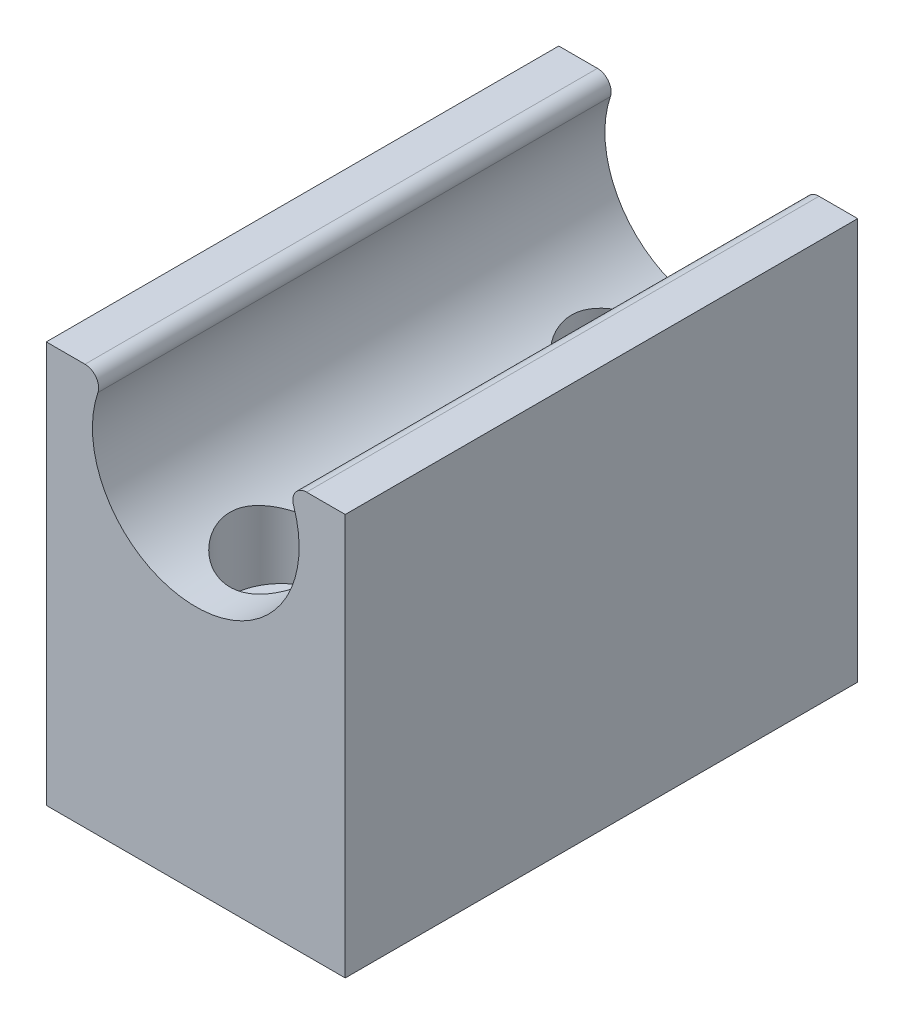
from build123d import *

# Parameters (mm, degrees)
BOSS_EXTRUDE1_DEPTH = 30
FILLET1_R           = 0.8
SKETCH3_R           = 3
CUT_EXTRUDE1_DEPTH  = 12.5
SKETCH4_R           = 1.55
CUT_EXTRUDE2_DEPTH  = 40.100032046


with BuildPart() as part:
    # Sketch1 → Boss-Extrude1 (new body)
    with BuildSketch(Plane.XY):
        with BuildLine():
            Line((-5.25, 11.75), (-8.75, 11.75))
            Line((-8.75, 11.75), (-8.75, -11.75))
            Line((-8.75, -11.75), (8.75, -11.75))
            Line((8.75, -11.75), (8.75, 11.75))
            Line((8.75, 11.75), (5.25, 11.75))
            ThreePointArc((5.25, 11.75), (0, 2.693340724), (-5.25, 11.75))
        make_face()
    extrude(amount=BOSS_EXTRUDE1_DEPTH)

    # Fillet1
    fillet1_edges = [part.edges().sort_by_distance(p)[0] for p in [
        (5.25, 11.75, 15),
        (-5.25, 11.75, 15),
    ]]
    fillet(fillet1_edges, radius=FILLET1_R)

    # Sketch3 → Cut-Extrude1 (cut)
    with BuildSketch(Plane(origin=(0, 11.75, 0), x_dir=(1, 0, 0), z_dir=(0, 1, 0))):
        with Locations((0, -5)):
            Circle(SKETCH3_R)
        with Locations((0, -25)):
            Circle(SKETCH3_R)
    extrude(amount=-CUT_EXTRUDE1_DEPTH, mode=Mode.SUBTRACT)

    # Sketch4 → Cut-Extrude2 (cut, through all)
    with BuildSketch(Plane(origin=(0, 11.75, 0), x_dir=(1, 0, 0), z_dir=(0, 1, 0))):
        with Locations((0, -5)):
            Circle(SKETCH4_R)
        with Locations((0, -25)):
            Circle(SKETCH4_R)
    extrude(amount=-CUT_EXTRUDE2_DEPTH, mode=Mode.SUBTRACT)


solid = part.part
